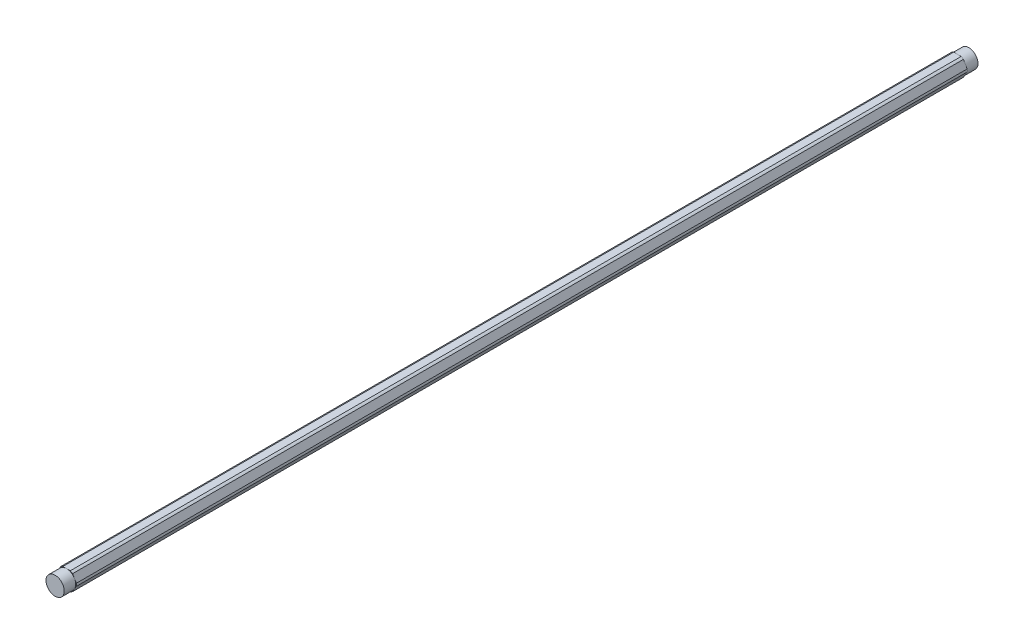
from build123d import *

# Parameters (mm, degrees)
BOSS_EXTRUDE1_DEPTH = 317.5
SKETCH3_OUTSIDE_W   = 143.724
SKETCH3_OUTSIDE_H   = 141.76
SKETCH3_OUTSIDE_R   = 6.35
CUT_EXTRUDE2_DEPTH  = 7.9502
SKETCH4_OUTSIDE_W   = 143.724
SKETCH4_OUTSIDE_H   = 141.76
SKETCH4_OUTSIDE_R   = 6.858
CUT_EXTRUDE3_DEPTH  = 636.074079012


with BuildPart() as part:
    # Sketch1 → Boss-Extrude1 (new, symmetric)
    with BuildSketch(Plane.XY):
        Polygon((7.332348419, 0), (3.666174209, 6.35), (-3.666174209, 6.35), (-7.332348419, 0), (-3.666174209, -6.35), (3.666174209, -6.35), align=None)
    extrude(amount=BOSS_EXTRUDE1_DEPTH, both=True)

    # Sketch3 outside → Cut-Extrude2 (cut)
    with BuildSketch(Plane.XY.offset(317.5)):
        Rectangle(SKETCH3_OUTSIDE_W, SKETCH3_OUTSIDE_H)
        Circle(SKETCH3_OUTSIDE_R, mode=Mode.SUBTRACT)
    cut_extrude2 = extrude(amount=-CUT_EXTRUDE2_DEPTH, mode=Mode.SUBTRACT)

    # Mirror1: Cut-Extrude2 across plane
    add(cut_extrude2.mirror(Plane.XY), mode=Mode.SUBTRACT)

    # Sketch4 outside → Cut-Extrude3 (cut, through all)
    with BuildSketch(Plane.XY.offset(317.5)):
        Rectangle(SKETCH4_OUTSIDE_W, SKETCH4_OUTSIDE_H)
        Circle(SKETCH4_OUTSIDE_R, mode=Mode.SUBTRACT)
    extrude(amount=-CUT_EXTRUDE3_DEPTH, mode=Mode.SUBTRACT)


solid = part.part
